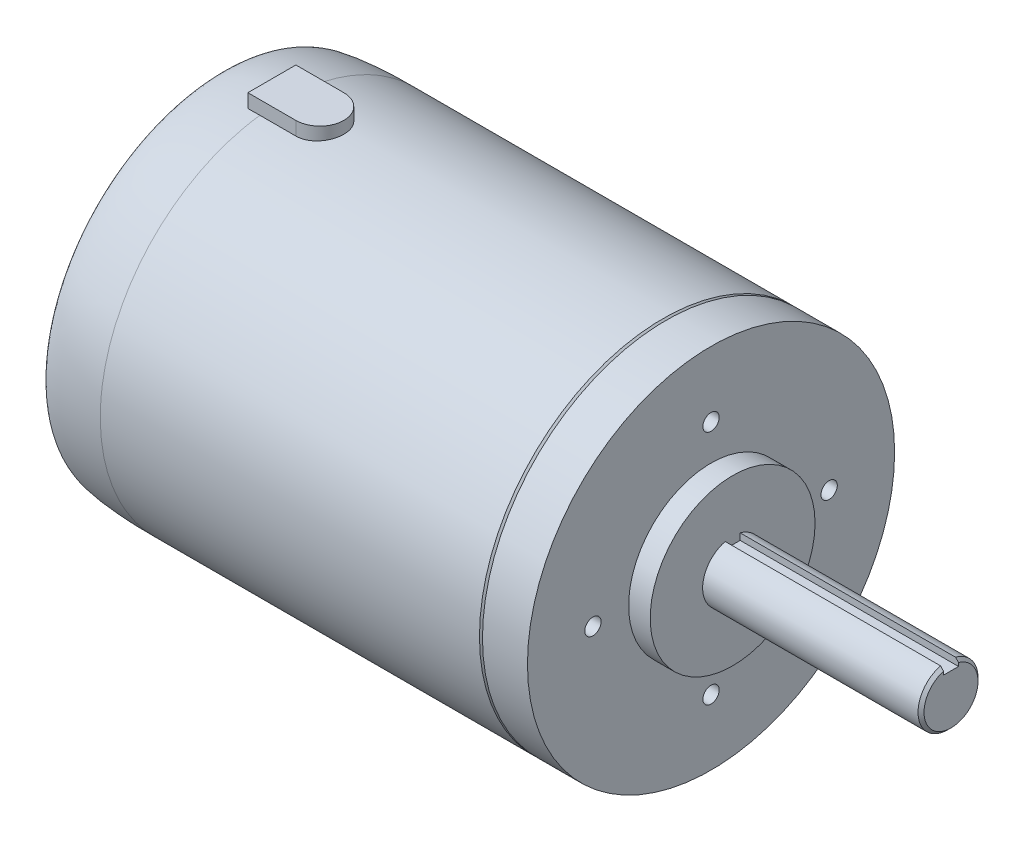
from build123d import *

# Parameters (mm, degrees)
FILLET1_SIZE              = 1.27
FILLET1_SIZE_2            = 12.7
SKETCH3_W                 = 3.175
SKETCH3_H                 = 3.175
CUT_EXTRUDE1_DEPTH        = 46.228
F_4_40_TAPPED_HOLE1_D     = 2.2606
F_4_40_TAPPED_HOLE1_DEPTH = 7.62
F_4_40_TAPPED_HOLE1_TIP   = 0.679152758
CIRPATTERN1_COUNT         = 4
BOSS_EXTRUDE1_DEPTH       = 41.402


# Read off the part's stored shape, not the designer's step: #6-32 Tapped Hole1
with BuildPart() as part:
    # Sketch2 → Revolve1 (revolve)
    with BuildSketch(Plane.XY, mode=Mode.PRIVATE) as revolve1_sk:
        Polygon((50.8, 0), (-115.824, 0), (-115.824, 4.7625), (-103.124, 4.7625), (-103.124, 38.862), (-10.16, 38.862), (-9.525, 38.227), (-9.525, 38.862), (0, 38.862), (0, 17.4498), (4.572, 17.4498), (4.572, 6.35), (50.165, 6.35), (50.8, 5.715), align=None)
    revolve(revolve1_sk.sketch.rotate(Axis((88.99, 0, 0), (-1, 0, 0)), 90), axis=Axis((88.99, 0, 0), (-1, 0, 0)))

    # Fillet1
    # an asymmetric fillet: 12.7, 1.27 mm, written as the material it takes off along each edge
    with BuildSketch(Plane(origin=(-103.124, 0, 0), x_dir=(0, 0, -1), z_dir=(0, 1, 0))) as fillet1_piece_1:
        with BuildLine():
            Bezier((38.862 - FILLET1_SIZE, 0), (38.862, 0), (38.862, -FILLET1_SIZE_2), weights=[1, 0.707106781, 1])
            Line((38.862, -FILLET1_SIZE_2), (38.862, 0))
            Line((38.862, 0), (38.862 - FILLET1_SIZE, 0))
        make_face()
    revolve(axis=Axis((-103.124, 0, 0), (-1, 0, 0)), mode=Mode.SUBTRACT)

    # Sketch3 → Cut-Extrude1 (cut)
    with BuildSketch(Plane(origin=(50.8, 0, 0), x_dir=(0, 0, -1), z_dir=(1, 0, 0))):
        with Locations((0, 6.35)):
            Rectangle(SKETCH3_W, SKETCH3_H)
    extrude(amount=-CUT_EXTRUDE1_DEPTH, mode=Mode.SUBTRACT)

    # Sketch8 → #8-32 Tapped Hole3 (revolve, cut)
    with BuildSketch(Plane(origin=(0, 0, -25), x_dir=(0, 0, -1), z_dir=(0, 1, 0))):
        Polygon((0, 0), (0, 11.705806461), (1.7272, 10.668), (1.7272, 0), align=None)
    f_8_32_tapped_hole3 = revolve(axis=Axis((6.35, 0, -25), (-1, 0, 0)), mode=Mode.SUBTRACT)

    # #6-32 Tapped Hole1 outline → #6-32 Tapped Hole1 (revolve, cut)
    with BuildSketch(Plane(origin=(0, 19.813624417, 28.296788218), x_dir=(0, 1, 0), z_dir=(0, 0, -1))):
        Polygon((1.35255, -93.726), (0, -92.91330597), (0, -103.124), (1.35255, -103.124), align=None)
    f_6_32_tapped_hole1 = revolve(axis=Axis((0, 19.813624417, 28.296788218), (1, 0, 0)), mode=Mode.SUBTRACT)

    # #4-40 Tapped Hole1
    with Locations(Plane.ZY.offset(103.124)):
        with Locations((-23, 0), (23, 0)):
            Hole(F_4_40_TAPPED_HOLE1_D / 2, depth=F_4_40_TAPPED_HOLE1_DEPTH)
            with Locations((0, 0, -(F_4_40_TAPPED_HOLE1_DEPTH + F_4_40_TAPPED_HOLE1_TIP / 2))):  # 118° drill point
                Cone(0, F_4_40_TAPPED_HOLE1_D / 2, F_4_40_TAPPED_HOLE1_TIP, mode=Mode.SUBTRACT)

    # CirPattern1: #8-32 Tapped Hole3, #6-32 Tapped Hole1 ×4 about axis
    cirpattern1_axis = Axis((0, 0, 0), (1, 0, 0))
    add([f_8_32_tapped_hole3.rotate(cirpattern1_axis, i * 360 / CIRPATTERN1_COUNT) for i in range(1, CIRPATTERN1_COUNT)], mode=Mode.SUBTRACT)
    add([f_6_32_tapped_hole1.rotate(cirpattern1_axis, i * 360 / CIRPATTERN1_COUNT) for i in range(1, CIRPATTERN1_COUNT)], mode=Mode.SUBTRACT)

    # Sketch12 → Boss-Extrude1 (add)
    with BuildSketch(Plane(origin=(0, 0, 0), x_dir=(1, 0, 0), z_dir=(0, 1, 0))):
        with BuildLine():
            Line((-92.964, -5.08), (-82.804, -5.08))
            ThreePointArc((-82.804, -5.08), (-77.724, 0), (-82.804, 5.08))
            Line((-82.804, 5.08), (-92.964, 5.08))
            Line((-92.964, 5.08), (-92.964, -5.08))
        make_face()
    extrude(amount=BOSS_EXTRUDE1_DEPTH)


solid = part.part
